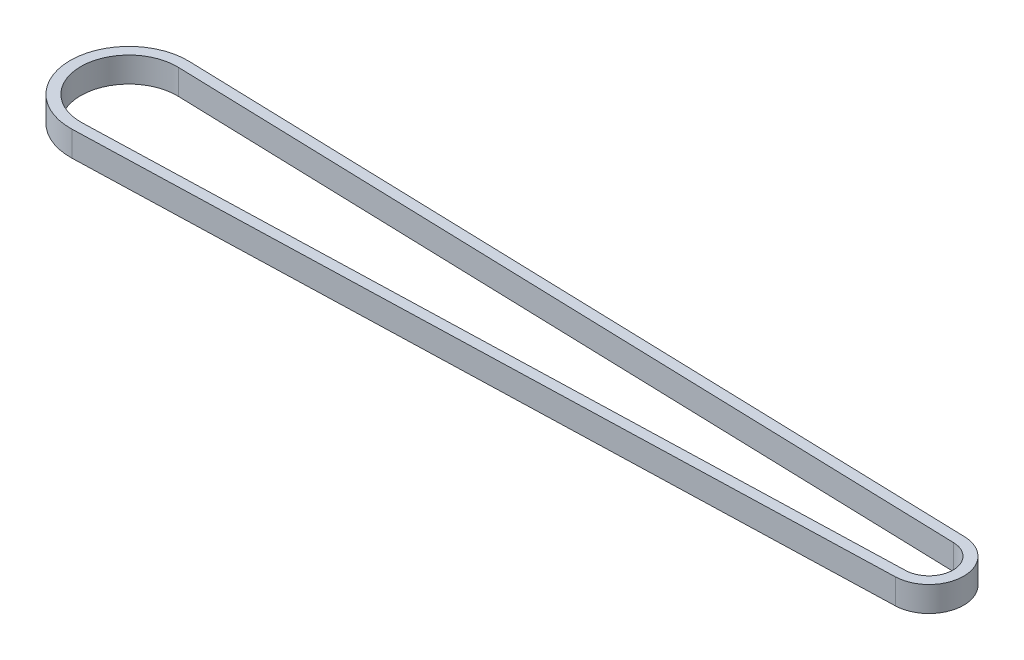
from build123d import *

# Parameters (mm, degrees)
BOSS_EXTRUDE1_DEPTH = 5.9944


with BuildPart() as part:
    # Sketch1 → Boss-Extrude1 (new body)
    with BuildSketch(Plane(origin=(0, 0, 0), x_dir=(1, 0, 0), z_dir=(0, 1, 0))):
        with BuildLine():
            Line((-94.8309, 13.963712085), (95.49765, 8.251284414))
            ThreePointArc((95.49765, 8.251284414), (103.505, 0), (95.49765, -8.251284414))
            Line((95.49765, -8.251284414), (-94.8309, -13.963712085))
            ThreePointArc((-94.8309, -13.963712085), (-109.22, 0), (-94.8309, 13.963712085))
        make_face()
        with BuildLine():
            Line((-94.905650676, 11.45022326), (95.422212838, 5.726381056))
            ThreePointArc((95.422212838, 5.726381056), (100.97897, 0), (95.422212838, -5.726381056))
            Line((95.422212838, -5.726381056), (-94.905650676, -11.45022326))
            ThreePointArc((-94.905650676, -11.45022326), (-106.7054, 0), (-94.905650676, 11.45022326))
        make_face(mode=Mode.SUBTRACT)
    extrude(amount=BOSS_EXTRUDE1_DEPTH)


solid = part.part
